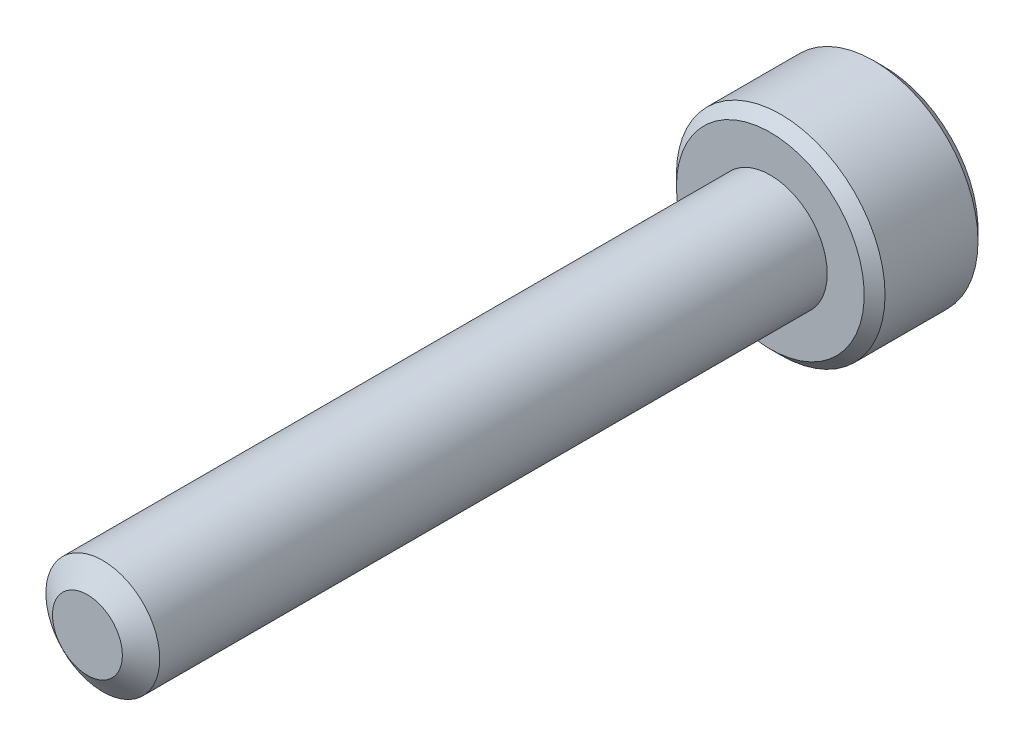
from build123d import *

# Parameters (mm, degrees)
SKETCH1_R          = 1.5
EXTRUDE1_DEPTH     = 18
SKETCH6_R          = 2.75
EXTRUDE2_DEPTH     = 3
CUT_EXTRUDE1_DEPTH = 1.875
CHAMFER1_SIZE      = 0.275


with BuildPart() as part:
    # Sketch1 → Extrude1 (new body)
    with BuildSketch(Plane.XY):
        Circle(SKETCH1_R)
    extrude(amount=-EXTRUDE1_DEPTH)

    # Sketch4 → Cut-Revolve1 (revolve, cut)
    with BuildSketch(Plane(origin=(0, 0, 0), x_dir=(0, 0, -1), z_dir=(1, 0, 0))):
        Polygon((0.405251783, 1.5), (0, 0.921240474), (0, 1.5), align=None)
    revolve(axis=Axis((0, 0, 0), (0, 0, -1)), mode=Mode.SUBTRACT)

    # Sketch6 → Extrude2 (add)
    with BuildSketch(Plane(origin=(0, 0, -18), x_dir=(-1, 0, 0), z_dir=(0, 0, -1))):
        Circle(SKETCH6_R)
    extrude(amount=EXTRUDE2_DEPTH)

    # Sketch7 → Cut-Extrude1 (cut)
    with BuildSketch(Plane(origin=(0, 0, -21), x_dir=(-1, 0, 0), z_dir=(0, 0, -1))):
        Polygon((0, 1.443375673), (-1.25, 0.721687836), (-1.25, -0.721687836), (0, -1.443375673), (1.25, -0.721687836), (1.25, 0.721687836), align=None)
    extrude(amount=-CUT_EXTRUDE1_DEPTH, mode=Mode.SUBTRACT)

    # Cut-Extrude2 cone 1 section (through the dimple's axis) → Cut-Extrude2 (revolve, cut)
    with BuildSketch(Plane(origin=(0, 0, -21), x_dir=(0, 1, 0), z_dir=(1, 0, 0))):
        Polygon((0, 0), (1.443375673, 0), (0, 1.443375673), align=None)
    revolve(axis=Axis((0, 0, -21), (0, 0, 1)), mode=Mode.SUBTRACT)

    # Chamfer1
    chamfer1_edges = [part.edges().sort_by_distance(p)[0] for p in [
        (2.75, 0, -21),
        (2.75, 0, -18),
    ]]
    chamfer(chamfer1_edges, length=CHAMFER1_SIZE)


solid = part.part
